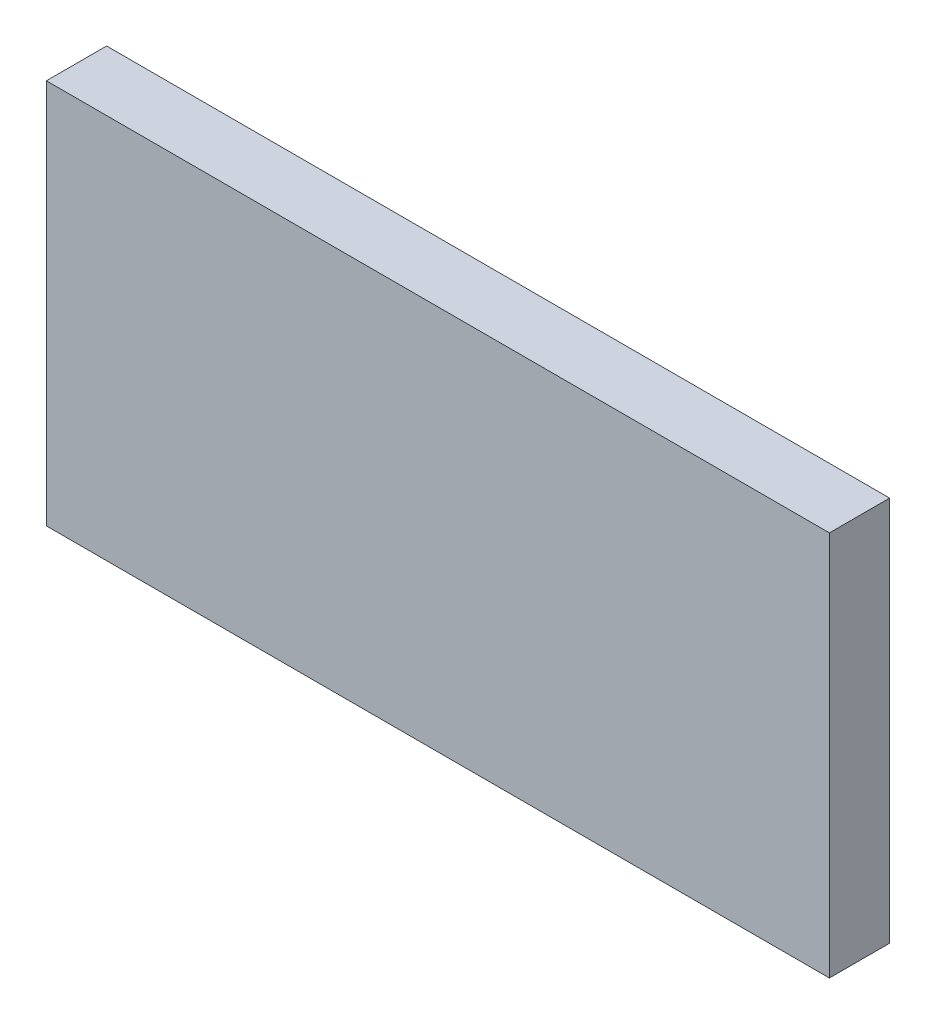
from build123d import *

# Parameters (mm, degrees)
SKETCH1_W            = 15
SKETCH1_H            = 20
BOSS_EXTRUDE1_DEPTH  = 230
SKETCH2_W            = 65
SKETCH2_H            = 40
BOSS_EXTRUDE6_DEPTH  = 5
SKETCH7_W            = 75
SKETCH7_H            = 15
BOSS_EXTRUDE7_DEPTH  = 5
SKETCH8_W            = 75
SKETCH8_H            = 15
BOSS_EXTRUDE8_DEPTH  = 5
SKETCH9_W            = 65
SKETCH9_H            = 32
BOSS_EXTRUDE11_DEPTH = 5
CUT_EXTRUDE1_DEPTH   = 240.635139326


with BuildPart() as part:
    # Sketch1 → Boss-Extrude1 (new body)
    with BuildSketch(Plane.XY):
        Rectangle(SKETCH1_W, SKETCH1_H)
    extrude(amount=BOSS_EXTRUDE1_DEPTH)

    # Sketch10 → Cut-Extrude1 (cut, through all)
    with BuildSketch(Plane.ZY.offset(7.5)):
        with BuildLine():
            Line((209.843145751, 2), (211.343145751, 2))
            ThreePointArc((211.343145751, 2), (223, 0), (211.343145751, -2))
            Line((211.343145751, -2), (209.843145751, -2))
            Line((209.843145751, -2), (209.843145751, 2))
        make_face()
    extrude(amount=-CUT_EXTRUDE1_DEPTH, mode=Mode.SUBTRACT)


with BuildPart() as body_2:
    # Sketch2 → Boss-Extrude6 (new body)
    with BuildSketch(Plane(origin=(0, 0, 0), x_dir=(-1, 0, 0), z_dir=(0, 0, -1))):
        with Locations((0, 30)):
            Rectangle(SKETCH2_W, SKETCH2_H)
    extrude(amount=-BOSS_EXTRUDE6_DEPTH)


with BuildPart() as body_3:
    # Sketch7 → Boss-Extrude7 (new body)
    with BuildSketch(Plane(origin=(32.5, 0, 0), x_dir=(0, 0, -1), z_dir=(1, 0, 0))):
        with Locations((-37.5, 30)):
            Rectangle(SKETCH7_W, SKETCH7_H)
    extrude(amount=BOSS_EXTRUDE7_DEPTH)


with BuildPart() as body_4:
    # Sketch8 → Boss-Extrude8 (new body)
    with BuildSketch(Plane.ZY.offset(32.5)):
        with Locations((37.5, 30)):
            Rectangle(SKETCH8_W, SKETCH8_H)
    extrude(amount=BOSS_EXTRUDE8_DEPTH)


with BuildPart() as body_5:
    # Sketch9 → Boss-Extrude11 (new body)
    with BuildSketch(Plane.XY.offset(75)):
        with Locations((0, 26)):
            Rectangle(SKETCH9_W, SKETCH9_H)
    extrude(amount=-BOSS_EXTRUDE11_DEPTH)


solid = body_5.part
